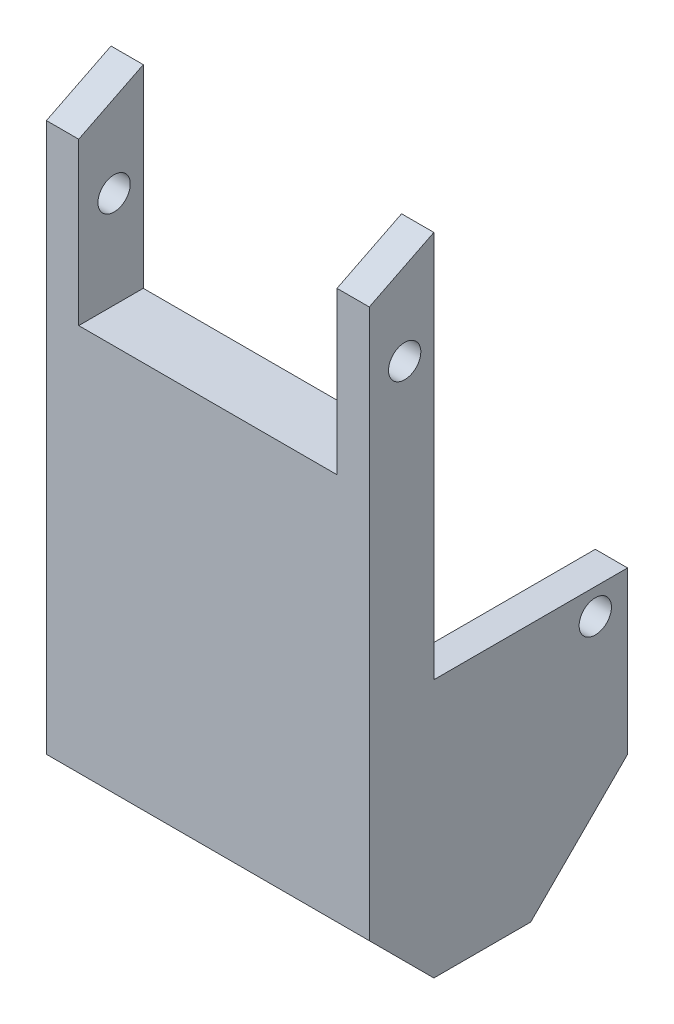
from build123d import *

# Parameters (mm, degrees)
SKETCH_1_W                = 5
SKETCH_1_H                = 10
EXTRUDE_1_DEPTH           = 4
CUT_EXTRUDE_1_DEPTH       = 9.124038405
CUT_EXTRUDE_1_DEPTH_BACK  = 9.124038405
CUT_EXTRUDE_2_DEPTH       = 9.124038405
CUT_EXTRUDE_2_DEPTH_BACK  = 9.124038405
SKETCH_6_W                = 4
SKETCH_6_H                = 3
CUT_EXTRUDE_3_DEPTH       = 2.5
SKETCH_7_W                = 4
SKETCH_7_H                = 3
CUT_EXTRUDE_4_DEPTH       = 2.5
CUT_EXTRUDE_5_DEPTH       = 9.124038405
CUT_EXTRUDE_5_DEPTH_BACK  = 9.124038405
CUT_EXTRUDE_10_DEPTH      = 9.124038405
CUT_EXTRUDE_10_DEPTH_BACK = 5
SKETCH_11_R               = 0.25
CUT_EXTRUDE_11_DEPTH      = 5
SKETCH_12_R               = 0.25
CUT_EXTRUDE_12_DEPTH      = 5


with BuildPart() as part:
    # 草图1 → 凸台-拉伸1 (new body)
    with BuildSketch(Plane.XY):
        Rectangle(SKETCH_1_W, SKETCH_1_H)
    extrude(amount=EXTRUDE_1_DEPTH)

    # 草图2 → 切除-拉伸1 (cut, two sides: drawn at the far end of the back side and taken through both)
    with BuildSketch(Plane(origin=(2.5, 0, 0), x_dir=(0, 0, -1), z_dir=(1, 0, 0)).offset(-CUT_EXTRUDE_1_DEPTH_BACK)):
        Polygon((-31.620459958, -9.310229979), (-4, 4.5), (-3, 5), (24.620459958, 18.810229979), (-3, 74.051149895), (-59.240919916, 45.930689937), align=None)
    extrude(amount=CUT_EXTRUDE_1_DEPTH + CUT_EXTRUDE_1_DEPTH_BACK, mode=Mode.SUBTRACT)

    # 草图3 → 切除-拉伸2 (cut, two sides: drawn at the far end of the back side and taken through both)
    with BuildSketch(Plane(origin=(2.5, 0, 0), x_dir=(0, 0, -1), z_dir=(1, 0, 0)).offset(-CUT_EXTRUDE_2_DEPTH_BACK)):
        Polygon((-3, 35.880613018), (-3, 5), (-3, -1), (0, -1), (30.880613018, -1), (76.363050598, 40.782734631), (42.48243758, 77.663347649), align=None)
    extrude(amount=CUT_EXTRUDE_2_DEPTH + CUT_EXTRUDE_2_DEPTH_BACK, mode=Mode.SUBTRACT)

    # 草图6 → 切除-拉伸3 (cut)
    with BuildSketch(Plane(origin=(0, -1, 0), x_dir=(1, 0, 0), z_dir=(0, 1, 0))):
        with Locations((0, -1.5)):
            Rectangle(SKETCH_6_W, SKETCH_6_H)
    extrude(amount=-CUT_EXTRUDE_3_DEPTH, mode=Mode.SUBTRACT)

    # 草图7 → 切除-拉伸4 (cut)
    with BuildSketch(Plane(origin=(0, 0, 3), x_dir=(-1, 0, 0), z_dir=(0, 0, -1))):
        with Locations((0, 3.5)):
            Rectangle(SKETCH_7_W, SKETCH_7_H)
    extrude(amount=-CUT_EXTRUDE_4_DEPTH, mode=Mode.SUBTRACT)

    # 草图8 → 切除-拉伸5 (cut, two sides: drawn at the far end of the back side and taken through both)
    with BuildSketch(Plane(origin=(2.5, 0, 0), x_dir=(0, 0, -1), z_dir=(1, 0, 0)).offset(-CUT_EXTRUDE_5_DEPTH_BACK)):
        Polygon((-25.835890872, 17.835890872), (-4, -4), (-3, -5), (18.835890872, -26.835890872), (-24.835890872, -70.507672616), (-69.507672616, -25.835890872), align=None)
    extrude(amount=CUT_EXTRUDE_5_DEPTH + CUT_EXTRUDE_5_DEPTH_BACK, mode=Mode.SUBTRACT)

    # 草图9 → 切除-拉伸10 (cut, two sides: drawn at the far end of the back side and taken through both)
    with BuildSketch(Plane(origin=(2.5, 0, 0), x_dir=(0, 0, -1), z_dir=(1, 0, 0)).offset(-CUT_EXTRUDE_10_DEPTH_BACK)):
        Polygon((-23.148447549, -26.648447549), (-1.5, -5), (0, -3.5), (21.648447549, 18.148447549), (64.945342647, -25.148447549), (20.148447549, -69.945342647), align=None)
    extrude(amount=CUT_EXTRUDE_10_DEPTH + CUT_EXTRUDE_10_DEPTH_BACK, mode=Mode.SUBTRACT)

    # 草图11 → 切除-拉伸11 (cut)
    with BuildSketch(Plane(origin=(2.5, 0, 0), x_dir=(0, 0, -1), z_dir=(1, 0, 0))):
        with Locations((-3.451895846, 3.5)):
            Circle(SKETCH_11_R)
    extrude(amount=-CUT_EXTRUDE_11_DEPTH, mode=Mode.SUBTRACT)

    # 草图12 → 切除-拉伸12 (cut)
    with BuildSketch(Plane(origin=(2.5, 0, 0), x_dir=(0, 0, -1), z_dir=(1, 0, 0))):
        with Locations((-0.5, -1.4)):
            Circle(SKETCH_12_R)
    extrude(amount=-CUT_EXTRUDE_12_DEPTH, mode=Mode.SUBTRACT)


solid = part.part
